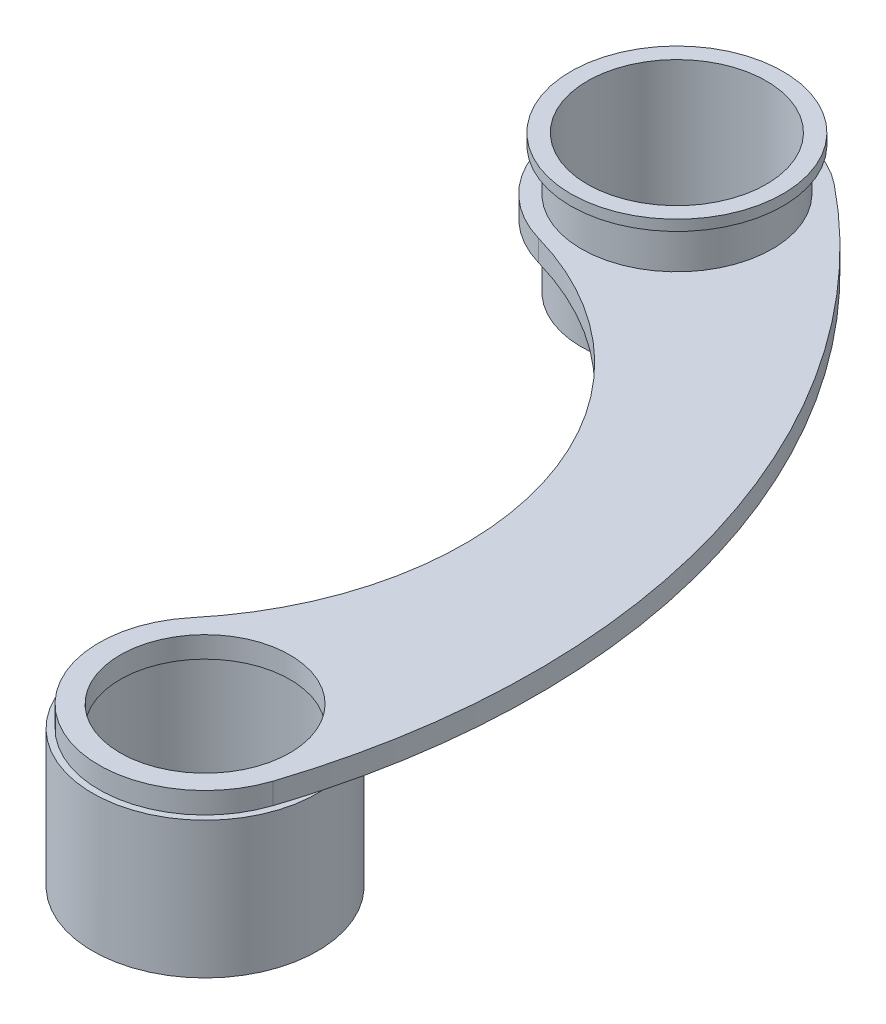
from build123d import *
from build123d.topology import SkipClean

# Parameters (mm, degrees)
CROQUIS1_R                    = 4.218255418
CROQUIS1_R_2                  = 4
SALIENTE_EXTRUIR1_DEPTH       = 1
SALIENTE_EXTRUIR2_START       = -4
SALIENTE_EXTRUIR2_OUTLINE_R   = 4.5
SALIENTE_EXTRUIR2_OUTLINE_R_2 = 4.218255418
SALIENTE_EXTRUIR2_DEPTH       = 6
CROQUIS3_R                    = 5
CROQUIS3_R_2                  = 4.218255418
SALIENTE_EXTRUIR3_DEPTH       = 0.5
CROQUIS4_R                    = 5.3
CROQUIS4_R_2                  = 4.5
SALIENTE_EXTRUIR5_DEPTH       = 0.1
CROQUIS5_R                    = 5.3
CROQUIS5_R_2                  = 5
SALIENTE_EXTRUIR6_DEPTH       = 6.337921


# Read off the part's stored shape, not the designer's step: Saliente-Extruir2
with BuildPart() as part:
    # Croquis1 → Saliente-Extruir1 (new body)
    with BuildSketch(Plane(origin=(0, 0, 0), x_dir=(1, 0, 0), z_dir=(0, 1, 0))):
        with BuildLine():
            ThreePointArc((3.313459582, 4.10165926), (-4.681239764, 2.42664735), (-1.441875065, -5.071845757))
            ThreePointArc((-1.441875065, -5.071845757), (8.628437932, -14.919813028), (5.858493799, -28.729993067))
            ThreePointArc((5.858493799, -28.729993067), (7.278526743, -36.308249114), (14.452018201, -33.482036353))
            ThreePointArc((14.452018201, -33.482036353), (14.728457578, -12.957711758), (3.313459582, 4.10165926))
        make_face()
        with Locations(Location((0, 0, 0), (0, 0, 270))):
            Circle(CROQUIS1_R, mode=Mode.SUBTRACT)
        with Locations(Location((9.698123587, -31.932686167, 0), (0, 0, 270))):
            Circle(CROQUIS1_R_2, mode=Mode.SUBTRACT)
    extrude(amount=SALIENTE_EXTRUIR1_DEPTH)

    # Saliente-Extruir2 outline → Saliente-Extruir2 (add)
    with SkipClean():  # the faces are left unmerged after this step: merging them gives an invalid solid
        with BuildSketch(Plane(origin=(0, 1, 0), x_dir=(1, 0, 0), z_dir=(0, 1, 0)).offset(SALIENTE_EXTRUIR2_START)):
            Circle(SALIENTE_EXTRUIR2_OUTLINE_R)
            Circle(SALIENTE_EXTRUIR2_OUTLINE_R_2, mode=Mode.SUBTRACT)
        extrude(amount=SALIENTE_EXTRUIR2_DEPTH)

    # Croquis3 → Saliente-Extruir3 (add)
    with BuildSketch(Plane(origin=(0, 3, 0), x_dir=(1, 0, 0), z_dir=(0, 1, 0))):
        with Locations(Location((0, 0, 0), (0, 0, 270))):
            Circle(CROQUIS3_R)
        with Locations(Location((0, 0, 0), (0, 0, 270))):
            Circle(CROQUIS3_R_2, mode=Mode.SUBTRACT)
    extrude(amount=SALIENTE_EXTRUIR3_DEPTH)

    # Croquis4 → Saliente-Extruir5 (add)
    with BuildSketch(Plane.XZ):
        with Locations(Location((9.698123587, 31.932686167, 0), (0, 0, 357.04362328))):
            Circle(CROQUIS4_R)
        with Locations(Location((9.698123587, 31.932686167, 0), (0, 0, 270))):
            Circle(CROQUIS4_R_2, mode=Mode.SUBTRACT)
    extrude(amount=SALIENTE_EXTRUIR5_DEPTH)

    # Croquis5 → Saliente-Extruir6 (add)
    with BuildSketch(Plane.XZ.offset(0.1)):
        with Locations(Location((9.698123587, 31.932686167, 0), (0, 0, 357.04362328))):
            Circle(CROQUIS5_R)
        with Locations(Location((9.698123587, 31.932686167, 0), (0, 0, 270))):
            Circle(CROQUIS5_R_2, mode=Mode.SUBTRACT)
    extrude(amount=SALIENTE_EXTRUIR6_DEPTH)


solid = part.part
